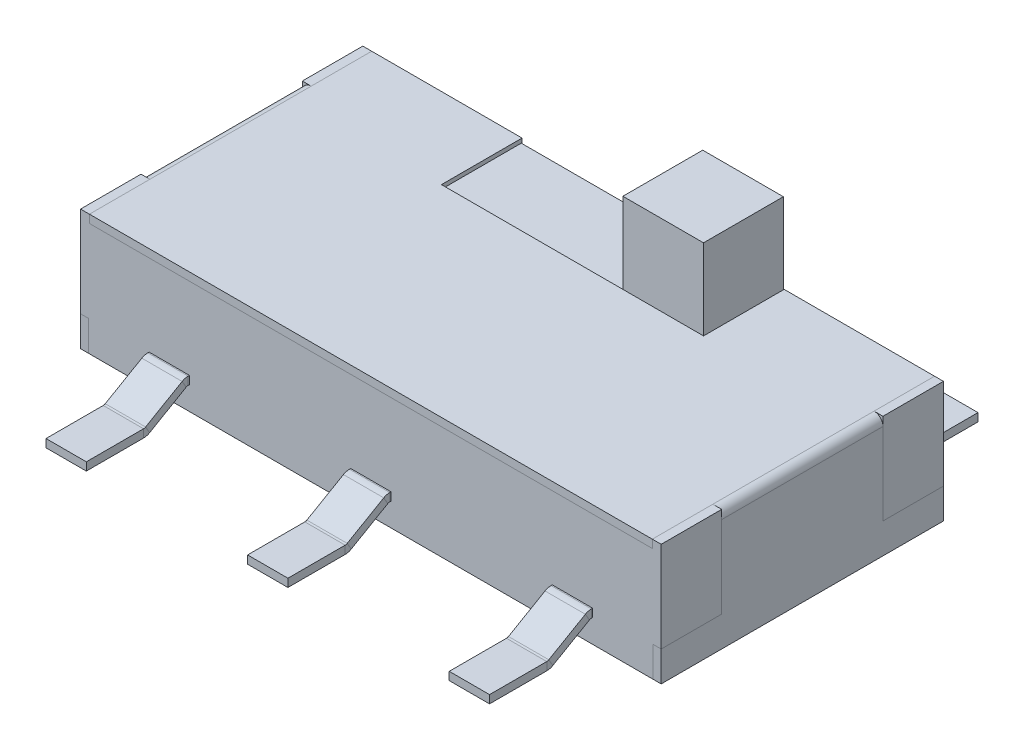
from build123d import *

# Parameters (mm, degrees)
SKETCH1_W           = 7.2
SKETCH1_H           = 3.5
BOSS_EXTRUDE1_DEPTH = 1.5
SKETCH2_R           = 0.425
BOSS_EXTRUDE2_DEPTH = 0.5
CHAMFER1_SIZE       = 0.2
CUT_EXTRUDE1_DEPTH  = 0.1
CUT_EXTRUDE2_DEPTH  = 0.1
SKETCH5_W           = 3.25
SKETCH5_H           = 1
CUT_EXTRUDE3_DEPTH  = 0.75
BASE_FLANGE2_DEPTH  = 1.75
SKETCH16_W          = 1.125
SKETCH16_H          = 0.75
CUT_EXTRUDE6_DEPTH  = 0.11
SKETCH17_W          = 3.25
SKETCH17_H          = 1
CUT_EXTRUDE7_DEPTH  = 0.1
SKETCH18_W          = 3.25
SKETCH18_H          = 0.99
BOSS_EXTRUDE3_DEPTH = 0.8
SKETCH20_W          = 1
SKETCH20_H          = 0.99
BOSS_EXTRUDE7_DEPTH = 1.05
BASE_FLANGE3_DEPTH  = 0.25
LPATTERN1_COUNT     = 2
LPATTERN1_PITCH     = 2.5
LPATTERN1_2_COUNT   = 2
LPATTERN1_2_PITCH   = 2.5


# Sheet-metal steps are written as plain solids
with BuildPart() as part:
    # Sketch1 → Boss-Extrude1 (new body)
    with BuildSketch(Plane(origin=(0, 0, 0), x_dir=(1, 0, 0), z_dir=(0, 1, 0))):
        Rectangle(SKETCH1_W, SKETCH1_H)
    extrude(amount=BOSS_EXTRUDE1_DEPTH)

    # Sketch2 → Boss-Extrude2 (add)
    with BuildSketch(Plane.XZ):
        with Locations(Location((-1.5, 0, 0), (0, 0, 270))):
            Circle(SKETCH2_R)
        with Locations(Location((1.5, 0, 0), (0, 0, 270))):
            Circle(SKETCH2_R)
    extrude(amount=BOSS_EXTRUDE2_DEPTH)

    # Chamfer1
    chamfer1_edges = [part.edges().sort_by_distance(p)[0] for p in [
        (-1.5, -0.5, 0.425),
        (1.5, -0.5, 0.425),
    ]]
    chamfer(chamfer1_edges, length=CHAMFER1_SIZE)

    # Sketch3 → Cut-Extrude1 (cut)
    with BuildSketch(Plane(origin=(3.6, 0, 0), x_dir=(0, 0, -1), z_dir=(1, 0, 0))):
        Polygon((-1, 1.5), (-1, 0.375), (-1.75, 0.375), (-1.75, 0), (1.75, 0), (1.75, 0.375), (1, 0.375), (1, 1.5), align=None)
    cut_extrude1 = extrude(amount=-CUT_EXTRUDE1_DEPTH, mode=Mode.SUBTRACT)

    # Mirror1: Cut-Extrude1 across plane
    add(cut_extrude1.mirror(Plane(origin=(0, 0, 0), x_dir=(0, 0, 1), z_dir=(1, 0, 0))), mode=Mode.SUBTRACT)

    # Sketch4 → Cut-Extrude2 (cut)
    with BuildSketch(Plane(origin=(0, 1.5, 0), x_dir=(1, 0, 0), z_dir=(0, 1, 0))):
        Polygon((-3.49, 1), (-3.5, 1), (-3.5, -1), (-3.49, -1), (-3.49, -1.75), (3.49, -1.75), (3.49, -1), (3.5, -1), (3.5, 1), (3.49, 1), (3.49, 1.75), (-3.49, 1.75), align=None)
    extrude(amount=-CUT_EXTRUDE2_DEPTH, mode=Mode.SUBTRACT)

    # Sketch5 → Cut-Extrude3 (cut)
    with BuildSketch(Plane(origin=(0, 1.4, 0), x_dir=(1, 0, 0), z_dir=(0, 1, 0))):
        with Locations((0, 1.25)):
            Rectangle(SKETCH5_W, SKETCH5_H)
    extrude(amount=-CUT_EXTRUDE3_DEPTH, mode=Mode.SUBTRACT)

    # Sketch18 → Boss-Extrude3 (add)
    with BuildSketch(Plane(origin=(0, 0.65, 0), x_dir=(1, 0, 0), z_dir=(0, 1, 0))):
        with Locations((0, 1.245)):
            Rectangle(SKETCH18_W, SKETCH18_H)
    extrude(amount=BOSS_EXTRUDE3_DEPTH)


with BuildPart() as body_2:
    # Sketch6 → Base-Flange2 (new, symmetric)
    with BuildSketch(Plane(origin=(0, 0, 0), x_dir=(-1, 0, 0), z_dir=(0, 0, -1))):
        with BuildLine():
            Line((-3.5, 0), (-3.5, 1.39))
            ThreePointArc((-3.5, 1.39), (-3.497071068, 1.397071068), (-3.49, 1.4))
            Line((-3.49, 1.4), (3.49, 1.4))
            ThreePointArc((3.49, 1.4), (3.497071068, 1.397071068), (3.5, 1.39))
            Line((3.5, 1.39), (3.5, 0))
            Line((3.5, 0), (3.6, 0))
            Line((3.6, 0), (3.6, 1.39))
            ThreePointArc((3.6, 1.39), (3.567781746, 1.467781746), (3.49, 1.5))
            Line((3.49, 1.5), (-3.49, 1.5))
            ThreePointArc((-3.49, 1.5), (-3.567781746, 1.467781746), (-3.6, 1.39))
            Line((-3.6, 1.39), (-3.6, 0))
            Line((-3.6, 0), (-3.5, 0))
        make_face()
    extrude(amount=BASE_FLANGE2_DEPTH, both=True)

    # Sketch16 → Cut-Extrude6 (cut)
    with BuildSketch(Plane(origin=(-3.6, 0, 0), x_dir=(0, 1, 0), z_dir=(-1, 0, 0))):
        with Locations((0.9375, 1.375)):
            Rectangle(SKETCH16_W, SKETCH16_H)
        with Locations((0.9375, -1.375)):
            Rectangle(SKETCH16_W, SKETCH16_H)
    cut_extrude6 = extrude(amount=-CUT_EXTRUDE6_DEPTH, mode=Mode.SUBTRACT)

    # Mirror2: Cut-Extrude6 across plane
    add(cut_extrude6.mirror(Plane(origin=(0, 0, 0), x_dir=(0, 0, 1), z_dir=(1, 0, 0))), mode=Mode.SUBTRACT)

    # Sketch17 → Cut-Extrude7 (cut)
    with BuildSketch(Plane(origin=(0, 1.5, 0), x_dir=(1, 0, 0), z_dir=(0, 1, 0))):
        with Locations((0, 1.25)):
            Rectangle(SKETCH17_W, SKETCH17_H)
    extrude(amount=-CUT_EXTRUDE7_DEPTH, mode=Mode.SUBTRACT)


with BuildPart() as body_3:
    # Sketch20 → Boss-Extrude7 (new body)
    with BuildSketch(Plane(origin=(0, 1.45, 0), x_dir=(1, 0, 0), z_dir=(0, 1, 0))):
        with Locations((1.125, 1.245)):
            Rectangle(SKETCH20_W, SKETCH20_H)
    extrude(amount=BOSS_EXTRUDE7_DEPTH)


with BuildPart() as body_4:
    # Sketch26 → Base-Flange3 (new, symmetric)
    with BuildSketch(Plane(origin=(0, 0, 0), x_dir=(0, 0, -1), z_dir=(1, 0, 0))):
        with BuildLine():
            Line((1.654738661, 0.288675135), (1.765146426, 0.288675135))
            ThreePointArc((1.765146426, 0.288675135), (1.778087378, 0.286971426), (1.790146426, 0.281976405))
            Line((1.790146426, 0.281976405), (2.243736264, 0.020096189))
            ThreePointArc((2.243736264, 0.020096189), (2.279913408, 0.005111126), (2.318736264, 0))
            Line((2.318736264, 0), (3.028543886, 0))
            Line((3.028543886, 0), (3.028543886, 0.1))
            Line((3.028543886, 0.1), (2.318736264, 0.1))
            ThreePointArc((2.318736264, 0.1), (2.305795312, 0.101703709), (2.293736264, 0.10669873))
            Line((2.293736264, 0.10669873), (1.840146426, 0.368578945))
            ThreePointArc((1.840146426, 0.368578945), (1.803969283, 0.383564009), (1.765146426, 0.388675135))
            Line((1.765146426, 0.388675135), (1.654738661, 0.388675135))
            Line((1.654738661, 0.388675135), (1.654738661, 0.288675135))
        make_face()
    extrude(amount=BASE_FLANGE3_DEPTH, both=True)


with BuildPart() as lpattern1_1:
    # LPattern1: pattern copy
    add(body_4.part.moved(Location(Vector(1, 0, 0) * (1 * LPATTERN1_PITCH))))


with BuildPart() as lpattern1_2_1:
    # LPattern1 2: pattern copy
    add(body_4.part.moved(Location(Vector(-1, 0, 0) * (1 * LPATTERN1_2_PITCH))))


with BuildPart() as body_7:
    # Mirror3: mirrored copy
    add(lpattern1_1.part.mirror(Plane(origin=(0, 0, 0), x_dir=(1, 0, 0), z_dir=(0, 0, -1))))


with BuildPart() as body_8:
    # Mirror3 2: mirrored copy
    add(body_4.part.mirror(Plane(origin=(0, 0, 0), x_dir=(1, 0, 0), z_dir=(0, 0, -1))))


with BuildPart() as body_9:
    # Mirror3 3: mirrored copy
    add(lpattern1_2_1.part.mirror(Plane(origin=(0, 0, 0), x_dir=(1, 0, 0), z_dir=(0, 0, -1))))


solid = Compound([part.part, body_2.part, body_3.part, body_4.part, lpattern1_1.part, lpattern1_2_1.part, body_7.part, body_8.part, body_9.part])
